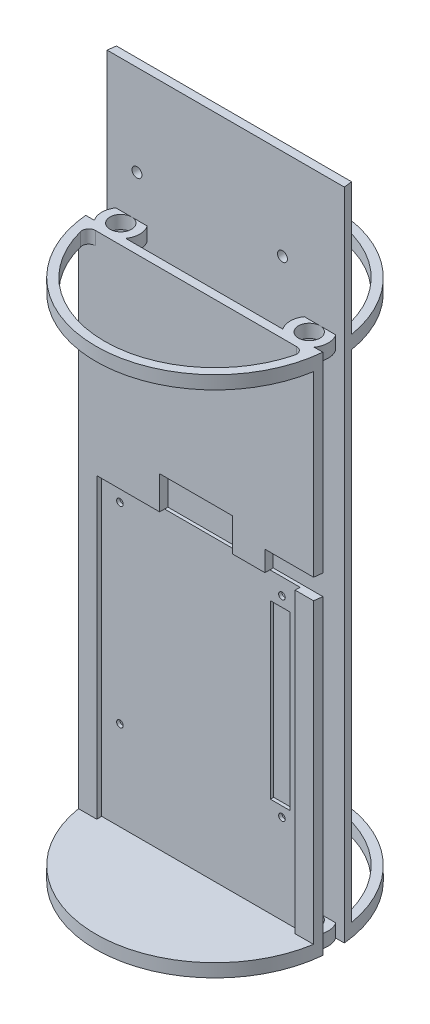
from build123d import *

# Parameters (mm, degrees)
SKETCH1_R           = 36
BOSS_EXTRUDE1_DEPTH = 4
BOSS_EXTRUDE2_DEPTH = 90
SKETCH4_R           = 3.25
CUT_EXTRUDE2_DEPTH  = 10
SKETCH3_W           = 60
SKETCH3_H           = 1.5
CUT_EXTRUDE1_DEPTH  = 90
SKETCH6_W           = 6
SKETCH6_H           = 52
CUT_EXTRUDE4_DEPTH  = 5
SKETCH7_R           = 1
CUT_EXTRUDE5_DEPTH  = 5
BOSS_EXTRUDE3_DEPTH = 60
SKETCH10_W          = 22
SKETCH10_H          = 10
CUT_EXTRUDE6_DEPTH  = 5
SKETCH11_R          = 3.25
BOSS_EXTRUDE4_DEPTH = 4
BOSS_EXTRUDE5_DEPTH = 40
SKETCH13_W          = 15
SKETCH13_H          = 6.157248713
CUT_EXTRUDE8_DEPTH  = 4
CUT_EXTRUDE9_DEPTH  = 4
SKETCH8_R           = 1.5
CUT_EXTRUDE7_DEPTH  = 5


with BuildPart() as part:
    # Sketch1 → Boss-Extrude1 (new body)
    with BuildSketch(Plane(origin=(0, 0, 0), x_dir=(1, 0, 0), z_dir=(0, 1, 0))):
        Circle(SKETCH1_R)
    extrude(amount=BOSS_EXTRUDE1_DEPTH)

    # Sketch2 → Boss-Extrude2 (add)
    with BuildSketch(Plane(origin=(0, 4, 0), x_dir=(1, 0, 0), z_dir=(0, 1, 0))):
        with BuildLine():
            ThreePointArc((35.537831954, -5.75), (35.717295076, -4.50275832), (35.85299848, -3.25))
            Line((35.85299848, -3.25), (-35.85299848, -3.25))
            ThreePointArc((-35.85299848, -3.25), (-35.717295076, -4.50275832), (-35.537831954, -5.75))
            Line((-35.537831954, -5.75), (35.537831954, -5.75))
        make_face()
        with BuildLine():
            ThreePointArc((35.85299848, 3.25), (35.717295076, 4.50275832), (35.537831954, 5.75))
            Line((35.537831954, 5.75), (-35.537831954, 5.75))
            ThreePointArc((-35.537831954, 5.75), (-35.717295076, 4.50275832), (-35.85299848, 3.25))
            Line((-35.85299848, 3.25), (35.85299848, 3.25))
        make_face()
    extrude(amount=BOSS_EXTRUDE2_DEPTH)

    # Sketch4 → Cut-Extrude2 (cut)
    with BuildSketch(Plane(origin=(0, 4, 0), x_dir=(1, 0, 0), z_dir=(0, 1, 0))):
        with Locations((-28.5, 0)):
            Circle(SKETCH4_R)
        with Locations((28.5, 0)):
            Circle(SKETCH4_R)
    extrude(amount=-CUT_EXTRUDE2_DEPTH, mode=Mode.SUBTRACT)

    # Sketch3 → Cut-Extrude1 (cut)
    with BuildSketch(Plane(origin=(0, 94, 0), x_dir=(1, 0, 0), z_dir=(0, 1, 0))):
        with Locations((0, -5)):
            Rectangle(SKETCH3_W, SKETCH3_H)
    extrude(amount=-CUT_EXTRUDE1_DEPTH, mode=Mode.SUBTRACT)

    # Sketch6 → Cut-Extrude4 (cut)
    with BuildSketch(Plane.XY.offset(4.25)):
        with Locations((24, 60)):
            Rectangle(SKETCH6_W, SKETCH6_H)
    extrude(amount=-CUT_EXTRUDE4_DEPTH, mode=Mode.SUBTRACT)

    # Sketch7 → Cut-Extrude5 (cut)
    with BuildSketch(Plane.XY.offset(4.25)):
        with Locations((-24.5, 89)):
            Circle(SKETCH7_R)
        with Locations((24.5, 89)):
            Circle(SKETCH7_R)
        with Locations((24.5, 31)):
            Circle(SKETCH7_R)
        with Locations((-24.5, 31)):
            Circle(SKETCH7_R)
    extrude(amount=-CUT_EXTRUDE5_DEPTH, mode=Mode.SUBTRACT)

    # Sketch9 → Boss-Extrude3 (add)
    with BuildSketch(Plane(origin=(0, 94, 0), x_dir=(1, 0, 0), z_dir=(0, 1, 0))):
        with BuildLine():
            Line((-35.85299848, 3.25), (35.85299848, 3.25))
            ThreePointArc((35.85299848, 3.25), (35.717295076, 4.50275832), (35.537831954, 5.75))
            Line((35.537831954, 5.75), (-35.537831954, 5.75))
            ThreePointArc((-35.537831954, 5.75), (-35.717295076, 4.50275832), (-35.85299848, 3.25))
        make_face()
        with BuildLine():
            Line((-35.537831954, -5.75), (35.537831954, -5.75))
            ThreePointArc((35.537831954, -5.75), (35.717295076, -4.50275832), (35.85299848, -3.25))
            Line((35.85299848, -3.25), (-35.85299848, -3.25))
            ThreePointArc((-35.85299848, -3.25), (-35.717295076, -4.50275832), (-35.537831954, -5.75))
        make_face()
    extrude(amount=BOSS_EXTRUDE3_DEPTH)

    # Sketch10 → Cut-Extrude6 (cut)
    with BuildSketch(Plane.XY.offset(5.75)):
        with Locations((0, 99)):
            Rectangle(SKETCH10_W, SKETCH10_H)
    extrude(amount=-CUT_EXTRUDE6_DEPTH, mode=Mode.SUBTRACT)

    # Sketch11 → Boss-Extrude4 (add)
    with BuildSketch(Plane(origin=(0, 154, 0), x_dir=(1, 0, 0), z_dir=(0, 1, 0))):
        with BuildLine():
            Line((-35.85299848, 3.25), (-33.24341649, 3.25))
            ThreePointArc((-33.24341649, 3.25), (-34.25, 0), (-33.24341649, -3.25))
            Line((-33.24341649, -3.25), (-35.85299848, -3.25))
            ThreePointArc((-35.85299848, -3.25), (0, -36), (35.85299848, -3.25))
            Line((35.85299848, -3.25), (33.24341649, -3.25))
            ThreePointArc((33.24341649, -3.25), (34.25, 0), (33.24341649, 3.25))
            Line((33.24341649, 3.25), (35.85299848, 3.25))
            ThreePointArc((35.85299848, 3.25), (0, 36), (-35.85299848, 3.25))
        make_face()
        with BuildLine():
            Line((30.430529424, 5.75), (-30.430529424, 5.75))
            ThreePointArc((-30.430529424, 5.75), (-32.009643299, 6.522645378), (-32.368662138, 8.243600631))
            ThreePointArc((-32.368662138, 8.243600631), (0, 33.401904735), (32.368662138, 8.243600631))
            ThreePointArc((32.368662138, 8.243600631), (32.009643299, 6.522645378), (30.430529424, 5.75))
        make_face(mode=Mode.SUBTRACT)
        with BuildLine():
            Line((-23.75658351, 3.25), (23.75658351, 3.25))
            ThreePointArc((23.75658351, 3.25), (22.75, 0), (23.75658351, -3.25))
            Line((23.75658351, -3.25), (-23.75658351, -3.25))
            ThreePointArc((-23.75658351, -3.25), (-22.75, 0), (-23.75658351, 3.25))
        make_face(mode=Mode.SUBTRACT)
        with BuildLine():
            ThreePointArc((32.368662138, -8.243600631), (0, -33.401904735), (-32.368662138, -8.243600631))
            ThreePointArc((-32.368662138, -8.243600631), (-32.009643299, -6.522645378), (-30.430529424, -5.75))
            Line((-30.430529424, -5.75), (30.430529424, -5.75))
            ThreePointArc((30.430529424, -5.75), (32.009643299, -6.522645378), (32.368662138, -8.243600631))
        make_face(mode=Mode.SUBTRACT)
        with Locations((28.5, 0)):
            Circle(SKETCH11_R, mode=Mode.SUBTRACT)
        with Locations((-28.5, 0)):
            Circle(SKETCH11_R, mode=Mode.SUBTRACT)
    extrude(amount=BOSS_EXTRUDE4_DEPTH)

    # Sketch12 → Boss-Extrude5 (add)
    with BuildSketch(Plane(origin=(0, 158, 0), x_dir=(1, 0, 0), z_dir=(0, 1, 0))):
        with BuildLine():
            Line((-35.85299848, 3.25), (35.85299848, 3.25))
            ThreePointArc((35.85299848, 3.25), (35.717295076, 4.50275832), (35.537831954, 5.75))
            Line((35.537831954, 5.75), (-35.537831954, 5.75))
            ThreePointArc((-35.537831954, 5.75), (-35.717295076, 4.50275832), (-35.85299848, 3.25))
        make_face()
    extrude(amount=BOSS_EXTRUDE5_DEPTH)

    # Sketch13 → Cut-Extrude8 (cut)
    with BuildSketch(Plane.XY.offset(5.75)):
        with Locations((28.35299848, 97.078624357)):
            Rectangle(SKETCH13_W, SKETCH13_H)
    extrude(amount=-CUT_EXTRUDE8_DEPTH, mode=Mode.SUBTRACT)

    # Sketch14 → Cut-Extrude9 (cut)
    with BuildSketch(Plane.XZ):
        with BuildLine():
            Line((23.75658351, 3.25), (-23.75658351, 3.25))
            ThreePointArc((-23.75658351, 3.25), (-22.75, 0), (-23.75658351, -3.25))
            Line((-23.75658351, -3.25), (23.75658351, -3.25))
            ThreePointArc((23.75658351, -3.25), (22.75, 0), (23.75658351, 3.25))
        make_face()
        with BuildLine():
            ThreePointArc((-33.24341649, -3.25), (-34.25, 0), (-33.24341649, 3.25))
            Line((-33.24341649, 3.25), (-35.85299848, 3.25))
            ThreePointArc((-35.85299848, 3.25), (-36, 0), (-35.85299848, -3.25))
            Line((-35.85299848, -3.25), (-33.24341649, -3.25))
        make_face()
        with BuildLine():
            Line((30.430529424, -5.75), (-30.430529424, -5.75))
            ThreePointArc((-30.430529424, -5.75), (-32.009643299, -6.522645378), (-32.368662138, -8.243600631))
            ThreePointArc((-32.368662138, -8.243600631), (0, -33.401904735), (32.368662138, -8.243600631))
            ThreePointArc((32.368662138, -8.243600631), (32.009643299, -6.522645378), (30.430529424, -5.75))
        make_face()
        with BuildLine():
            ThreePointArc((35.85299848, -3.25), (36, 0), (35.85299848, 3.25))
            Line((35.85299848, 3.25), (33.24341649, 3.25))
            ThreePointArc((33.24341649, 3.25), (34.25, 0), (33.24341649, -3.25))
            Line((33.24341649, -3.25), (35.85299848, -3.25))
        make_face()
    extrude(amount=-CUT_EXTRUDE9_DEPTH, mode=Mode.SUBTRACT)

    # Sketch8 → Cut-Extrude7 (cut)
    with BuildSketch(Plane(origin=(0, 0, -5.75), x_dir=(-1, 0, 0), z_dir=(0, 0, -1))):
        with Locations((-17.14700152, 170.5)):
            Circle(SKETCH8_R)
        with Locations((26.85299848, 170.5)):
            Circle(SKETCH8_R)
        with Locations((26.85299848, 82.5)):
            Circle(SKETCH8_R)
        with Locations((-17.14700152, 82.5)):
            Circle(SKETCH8_R)
    extrude(amount=-CUT_EXTRUDE7_DEPTH, mode=Mode.SUBTRACT)


solid = part.part
